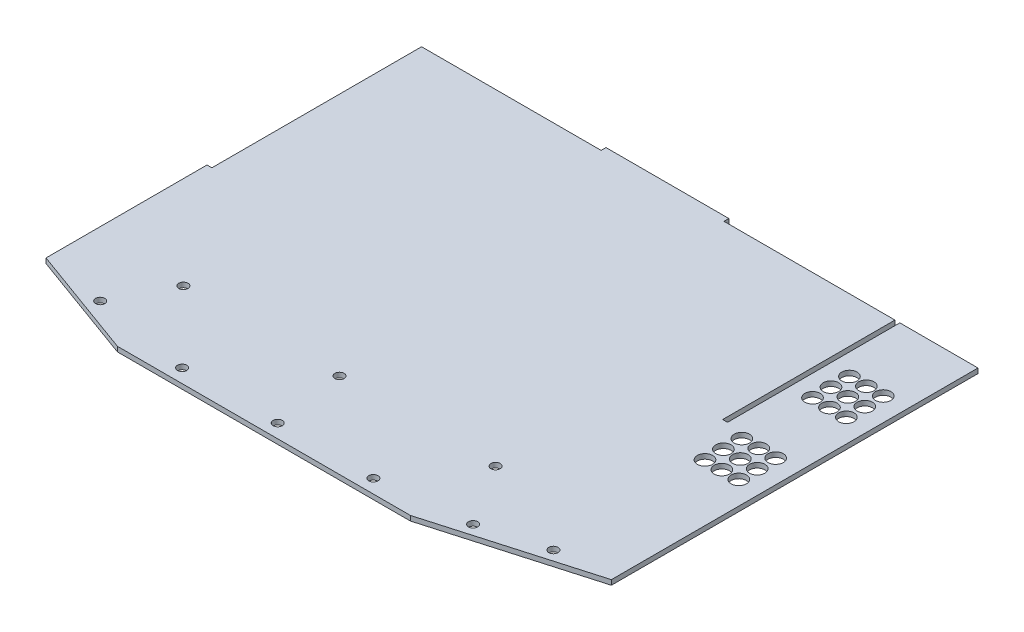
from build123d import *

# Parameters (mm, degrees)
SKETCH1_W               = 308.1112
SKETCH1_H               = 3.175
BOSS_EXTRUDE1_DEPTH     = 267.83
SKETCH3_W               = 155.702
SKETCH3_H               = 3.175
BOSS_EXTRUDE3_DEPTH     = 3.175
SKETCH4_W               = 50.87366
SKETCH4_H               = 3.175
BOSS_EXTRUDE4_DEPTH     = 267.83
CUT_EXTRUDE1_DEPTH      = 340.190761306
CUT_EXTRUDE3_DEPTH      = 340.190761306
SKETCH13_R              = 5
CUT_EXTRUDE4_DEPTH      = 340.190761306
LPATTERN1_COUNT         = 3
LPATTERN1_PITCH         = 12
SKETCH17_W              = 105.930619964
SKETCH17_H              = 3.175
BOSS_EXTRUDE5_DEPTH     = 3.175
SKETCH18_W              = 80
SKETCH18_H              = 3.175
BOSS_EXTRUDE6_DEPTH     = 3.175
SKETCH22_R              = 3
SKETCH22_R_2            = 0.027611819
CUT_EXTRUDE6_DEPTH      = 340.190761306
LPATTERN2_COUNT         = 3
LPATTERN2_PITCH         = 101.6
CUT_EXTRUDE7_DEPTH      = 340.190761306
CUT_EXTRUDE7_DEPTH_BACK = 340.190761306
SKETCH25_R              = 3
CUT_EXTRUDE8_DEPTH      = 3.175


with BuildPart() as part:
    # Sketch1 → Boss-Extrude1 (new body)
    with BuildSketch(Plane.XY):
        Rectangle(SKETCH1_W, SKETCH1_H)
    extrude(amount=BOSS_EXTRUDE1_DEPTH)

    # Sketch3 → Boss-Extrude3 (add)
    with BuildSketch(Plane(origin=(154.0556, 0, 0), x_dir=(0, 0, -1), z_dir=(1, 0, 0))):
        with Locations((-189.979, 0)):
            Rectangle(SKETCH3_W, SKETCH3_H)
    extrude(amount=BOSS_EXTRUDE3_DEPTH)

    # Sketch4 → Boss-Extrude4 (add)
    with BuildSketch(Plane.XY.offset(267.83)):
        with Locations((182.66743, 0)):
            Rectangle(SKETCH4_W, SKETCH4_H)
    extrude(amount=-BOSS_EXTRUDE4_DEPTH)

    # Sketch6 → Cut-Extrude1 (cut, through all)
    with BuildSketch(Plane(origin=(0, 1.5875, 0), x_dir=(1, 0, 0), z_dir=(0, 1, 0))):
        Polygon((208.10426, -238.620139294), (106.50426, -267.83), (208.10426, -267.83), align=None)
    extrude(amount=-CUT_EXTRUDE1_DEPTH, mode=Mode.SUBTRACT)

    # Sketch11 → Cut-Extrude3 (cut, through all)
    with BuildSketch(Plane.XZ.offset(1.5875)):
        Polygon((-154.0556, 242.43), (-84.2056, 267.83), (-154.0556, 267.83), align=None)
    extrude(amount=-CUT_EXTRUDE3_DEPTH, mode=Mode.SUBTRACT)

    # Sketch13 → Cut-Extrude4 (cut, through all)
    with BuildSketch(Plane.XZ.offset(1.5875)):
        with Locations((171.04991, 116.644763656)):
            Circle(SKETCH13_R)
        with Locations((182.04991, 116.644763656)):
            Circle(SKETCH13_R)
        with Locations((193.04991, 116.644763656)):
            Circle(SKETCH13_R)
        with Locations((171.04991, 46.644823778)):
            Circle(SKETCH13_R)
        with Locations((182.04991, 46.644823778)):
            Circle(SKETCH13_R)
        with Locations((193.04991, 46.644823778)):
            Circle(SKETCH13_R)
    cut_extrude4 = extrude(amount=-CUT_EXTRUDE4_DEPTH, mode=Mode.SUBTRACT)

    # LPattern1: Cut-Extrude4 ×3
    with Locations(*[(0, 0, i * LPATTERN1_PITCH) for i in range(1, LPATTERN1_COUNT)]):
        add(cut_extrude4, mode=Mode.SUBTRACT)

    # Sketch17 → Boss-Extrude5 (add)
    with BuildSketch(Plane.ZY.offset(154.0556)):
        with Locations((189.464690018, 0)):
            Rectangle(SKETCH17_W, SKETCH17_H)
    extrude(amount=BOSS_EXTRUDE5_DEPTH)

    # Sketch18 → Boss-Extrude6 (add)
    with BuildSketch(Plane(origin=(0, 0, 0), x_dir=(-1, 0, 0), z_dir=(0, 0, -1))):
        with Locations((-2.78399998, 0)):
            Rectangle(SKETCH18_W, SKETCH18_H)
    extrude(amount=BOSS_EXTRUDE6_DEPTH)

    # Sketch22 → Cut-Extrude6 (cut, through all)
    with BuildSketch(Plane(origin=(0, 1.5875, 0), x_dir=(1, 0, 0), z_dir=(0, 1, 0))):
        with Locations((-96.771937601, -212.306759128)):
            Circle(SKETCH22_R)
        with Locations((-96.771937601, -212.306759128)):
            Circle(SKETCH22_R_2, mode=Mode.SUBTRACT)
    cut_extrude6 = extrude(amount=-CUT_EXTRUDE6_DEPTH, mode=Mode.SUBTRACT)


with BuildPart() as cut_extrude6_piece_1:
    # of the separate pieces the step leaves, piece 1, a body of its own (cut_extrude6_pieces)
    add(part.part.solids().sort_by_distance((-154.0556, -1.5875, 0))[0])

    # LPattern2: Cut-Extrude6 ×3
    with Locations(*[(i * LPATTERN2_PITCH, 0, 0) for i in range(1, LPATTERN2_COUNT)]):
        add(cut_extrude6, mode=Mode.SUBTRACT)

    # Sketch23 → Cut-Extrude7 (cut, two sides: drawn at the far end of the back side and taken through both)
    with BuildSketch(Plane(origin=(0, 1.5875, 0), x_dir=(1, 0, 0), z_dir=(0, 1, 0)).offset(-CUT_EXTRUDE7_DEPTH_BACK)):
        Polygon((681.560448342, -546.290381215), (-154.0556, -242.43), (-157.2306, -241.275454545), (-992.846648342, 62.58492667), (-1600.567410773, -1608.647170014), (73.839685911, -2217.5224779), align=None)
    extrude(amount=CUT_EXTRUDE7_DEPTH + CUT_EXTRUDE7_DEPTH_BACK, mode=Mode.SUBTRACT)

    # Sketch25 → Cut-Extrude8 (cut)
    with BuildSketch(Plane.XZ.offset(1.5875)):
        with Locations((-115.3206, 247.915394364)):
            Circle(SKETCH25_R)
        with Locations((-50.97574, 258.94)):
            Circle(SKETCH25_R)
        with Locations((11.25426, 258.94)):
            Circle(SKETCH25_R)
        with Locations((73.48426, 258.94)):
            Circle(SKETCH25_R)
        with Locations((172.54426, 240.761310541)):
            Circle(SKETCH25_R)
        with Locations((131.90426, 252.445254824)):
            Circle(SKETCH25_R)
    extrude(amount=-CUT_EXTRUDE8_DEPTH, mode=Mode.SUBTRACT)


with BuildPart() as cut_extrude6_piece_2:
    # of the separate pieces the step leaves, piece 2, a body of its own (cut_extrude6_pieces)
    add(part.part.solids().sort_by_distance((-96.744325782, -1.5875, 212.306759128))[0])


solid = Compound([cut_extrude6_piece_1.part, cut_extrude6_piece_2.part])
